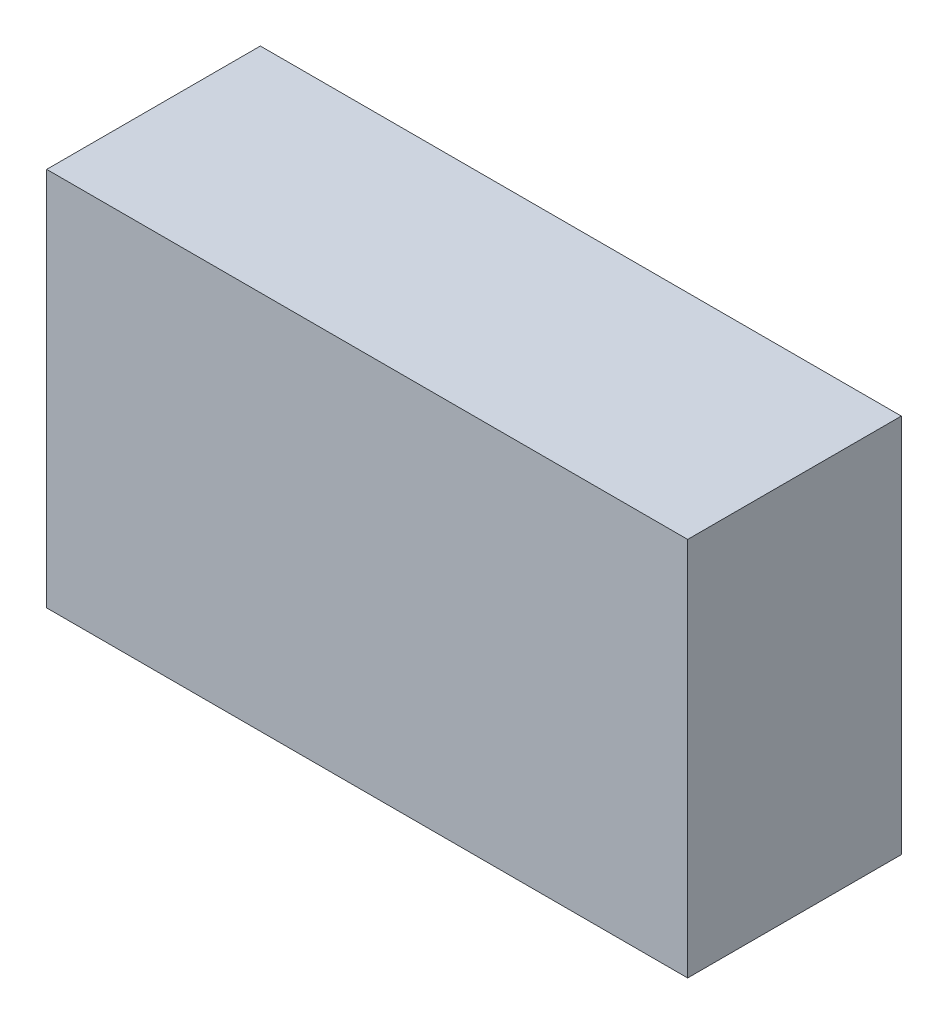
from build123d import *

# Parameters (mm, degrees)
SKETCH1_W           = 135
SKETCH1_H           = 80
BOSS_EXTRUDE1_DEPTH = 45
SKETCH2_R           = 1.5
CUT_EXTRUDE1_DEPTH  = 10
SKETCH3_R           = 1.5
CUT_EXTRUDE2_DEPTH  = 10
CAVITY1_START       = 6.25125
CAVITY1_DEPTH       = 67.4975
CAVITY1_START_2     = 5
CAVITY1_2_DEPTH     = 125


with BuildPart() as part:
    # Sketch1 → Boss-Extrude1 (new body)
    with BuildSketch(Plane.XY):
        with Locations((67.5, 40)):
            Rectangle(SKETCH1_W, SKETCH1_H)
    extrude(amount=-BOSS_EXTRUDE1_DEPTH)

    # Sketch2 → Cut-Extrude1 (cut)
    with BuildSketch(Plane(origin=(0, 0, -45), x_dir=(-1, 0, 0), z_dir=(0, 0, -1))):
        with Locations((-53.3, 40)):
            Circle(SKETCH2_R)
        with Locations((-53.3, 58.35)):
            Circle(SKETCH2_R)
        with Locations((-53.3, 21.65)):
            Circle(SKETCH2_R)
        with Locations((-23.3, 58.35)):
            Circle(SKETCH2_R)
        with Locations((-23.3, 21.65)):
            Circle(SKETCH2_R)
        with Locations((-115.7, 40)):
            Circle(SKETCH2_R)
        with Locations((-115.7, 62)):
            Circle(SKETCH2_R)
    extrude(amount=-CUT_EXTRUDE1_DEPTH, mode=Mode.SUBTRACT)

    # Sketch3 → Cut-Extrude2 (cut)
    with BuildSketch(Plane.ZY):
        with Locations((-15, 54.05)):
            Circle(SKETCH3_R)
        with Locations((-15, 25.95)):
            Circle(SKETCH3_R)
        with Locations((-31, 40)):
            Circle(SKETCH3_R)
    extrude(amount=-CUT_EXTRUDE2_DEPTH, mode=Mode.SUBTRACT)

    # Cavity1: read off the stored shape, not the designer's step
    # Cavity1 outline → Cavity1 (cut)
    with BuildSketch(Plane(origin=(0, 0, 0), x_dir=(1, 0, 0), z_dir=(0, 1, 0)).offset(CAVITY1_START)):
        Polygon((127.780327673, 40.35), (7.219672327, 40.35), (6.294, 5), (128.706, 5), align=None)
    extrude(amount=CAVITY1_DEPTH, mode=Mode.SUBTRACT)

    # Cavity1 2 outline → Cavity1 2 (add)
    with BuildSketch(Plane.YZ.offset(CAVITY1_START_2)):
        Polygon((73.74875, -5), (72.818495136, -40.35), (73.74875, -40.35), align=None)
        Polygon((7.181504864, -40.35), (6.25125, -5), (6.25125, -40.35), align=None)
    extrude(amount=CAVITY1_2_DEPTH)


solid = part.part
